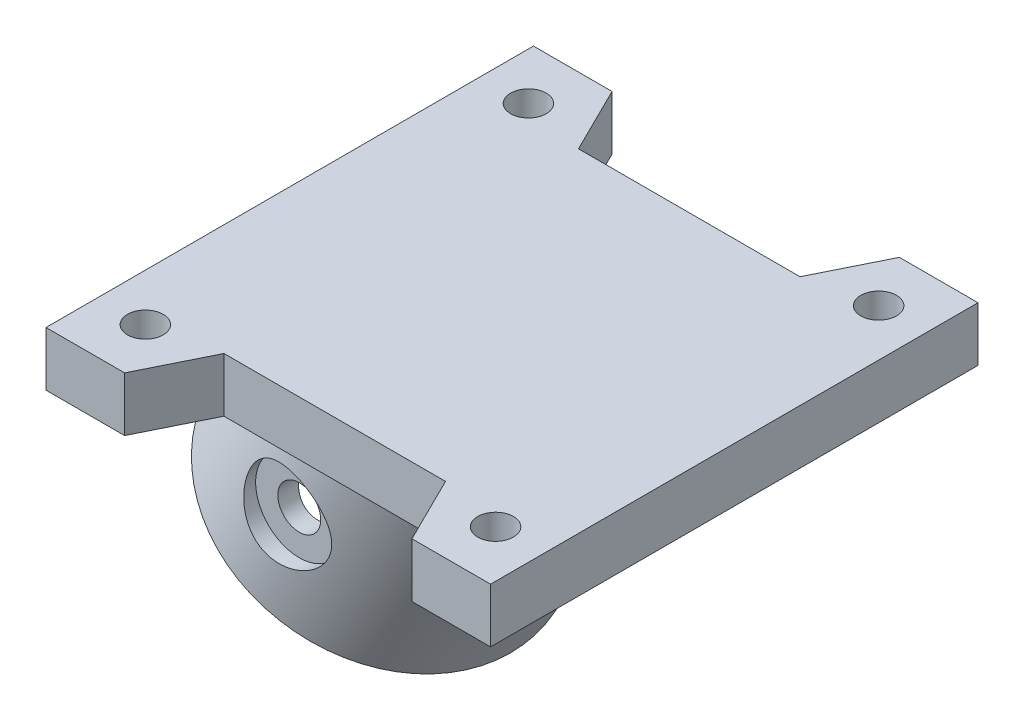
from build123d import *

# Parameters (mm, degrees)
BOSS_EXTRUDE1_DEPTH     = 3.8
CUT_EXTRUDE1_DEPTH      = 33.04999228
CUT_EXTRUDE2_DEPTH      = 30.761273573
CUT_EXTRUDE2_DEPTH_BACK = 30.761273573
SKETCH7_R               = 1.5
CUT_EXTRUDE3_DEPTH      = 8
SKETCH9_R               = 3.05
CUT_EXTRUDE4_DEPTH      = 8
SKETCH10_R              = 1.25
CUT_EXTRUDE5_DEPTH      = 33.0499924


with BuildPart() as part:
    # Sketch1 → Boss-Extrude1 (new body)
    with BuildSketch(Plane(origin=(0, 0, 0), x_dir=(1, 0, 0), z_dir=(0, 1, 0))):
        Polygon((-15.55, -17.05), (-15.55, 17.05), (-10.05, 17.05), (-7.75, 12.4), (7.75, 12.4), (10.05, 17.05), (15.55, 17.05), (15.55, -17.05), (10.05, -17.05), (7.75, -12.4), (-7.75, -12.4), (-10.05, -17.05), align=None)
    extrude(amount=BOSS_EXTRUDE1_DEPTH)

    # Revolve1: read off the stored shape, not the designer's step
    # Revolve1 outline → Revolve1 (revolve)
    with BuildSketch(Plane(origin=(-1.670959119, 0.964728697, 0), x_dir=(0.8660254037844398, -0.499999999999998, 0), z_dir=(0, 0, 1))):
        Polygon((10.200000298, -14.525), (10.200000248, 4.775000143), (3.79917118, 1.079479758), (0, 1.079479758), (0, -14.525), align=None)
    revolve(axis=Axis((-1.670959119, 0.964728697, 0), (0.499999999999998, 0.8660254037844398, 0)))

    # Sketch3 → Cut-Extrude1 (cut, through all)
    with BuildSketch(Plane(origin=(0, 3.8, 0), x_dir=(1, 0, 0), z_dir=(0, 1, 0))):
        Polygon((-10.05, 17.05), (-15.55, 17.05), (-15.55, -17.05), (-10.05, -17.05), (-7.75, -12.4), (7.75, -12.4), (10.05, -17.05), (15.55, -17.05), (15.55, 17.05), (10.05, 17.05), (7.75, 12.4), (-7.75, 12.4), align=None)
    extrude(amount=CUT_EXTRUDE1_DEPTH, mode=Mode.SUBTRACT)

    # Boundary-Cut1: read off the stored shape, not the designer's step
    # Boundary-Cut1: loft between two sections, ruled curve by curve
    boundary_cut1_from = [
        Edge.make_bspline([(-4.264195988, -14.310090618, 5.497330482), (-3.952600534, -14.489990338, 5.144451044), (-3.390059189, -14.814773735, 4.367149183), (-2.757568421, -15.17994245, 3.035429027), (-2.364627971, -15.406806725, 1.585508103), (-2.221728438, -15.489309808, 0.075173566), (-2.339233368, -15.421468305, -1.437931316), (-2.707711497, -15.208727358, -2.896270105), (-3.317731561, -14.85653211, -4.242306363), (-4.416065853, -14.222408511, -5.821756357), (-6.253782159, -13.161402507, -7.269581365), (-8.866989476, -11.652666559, -7.900430754), (-11.490387225, -10.138047163, -7.328308667), (-13.35210057, -9.063186462, -5.921916444), (-14.476778582, -8.413853309, -4.367433824), (-15.10932004, -8.048655327, -3.03533591), (-15.50227373, -7.821783409, -1.585450518), (-15.645207871, -7.739260344, -0.075222081), (-15.527690686, -7.807108923, 1.437904969), (-15.159193701, -8.019860756, 2.896296072), (-14.549188448, -8.372047453, 4.242316671), (-13.450871673, -9.006160938, 5.821729516), (-11.613084746, -10.067207715, 7.269617015), (-9.000025494, -11.575858178, 7.900380651), (-6.376366965, -13.090628136, 7.328435161), (-4.887386896, -13.95029118, 6.203089356), (-4.264195988, -14.310090618, 5.497330482)], [0, 0, 0, 0, 0.03125, 0.0625, 0.09375, 0.125, 0.15625, 0.1875, 0.21875, 0.25, 0.3125, 0.375, 0.4375, 0.5, 0.53125, 0.5625, 0.59375, 0.625, 0.65625, 0.6875, 0.71875, 0.75, 0.8125, 0.875, 0.9375, 1, 1, 1, 1], 3),
    ]
    boundary_cut1_to = [
        Edge.make_bspline([(3.535869827, 0, 6.0249567), (4.000260434, 0, 5.71827451), (4.874892388, 0, 5.020718912), (5.953015986, 0, 3.734542034), (6.720260155, 0, 2.238505144), (7.096013388, 0, 0.597243156), (7.030810986, 0, -1.085759731), (6.533226027, 0, -2.693977998), (5.66704479, 0, -4.133167867), (4.126269006, 0, -5.75895362), (1.680235047, 0, -7.172531093), (-1.628432874, 0, -7.851036071), (-4.989185483, 0, -7.528189152), (-7.581050356, 0, -6.415888298), (-9.330615811, 0, -5.020904789), (-10.408619135, 0, -3.734578971), (-11.176149314, 0, -2.238388975), (-11.55202821, 0, -0.597306131), (-11.48668895, 0, 1.0858282), (-10.988969574, 0, 2.693884042), (-10.123088416, 0, 4.133306502), (-8.582018083, 0, 5.758852747), (-6.136208886, 0, 7.172596545), (-2.827313809, 0, 7.85100057), (0.53292915, 0, 7.528284962), (2.607088614, 0, 6.63832108), (3.535869827, 0, 6.0249567)], [0, 0, 0, 0, 0.03125, 0.0625, 0.09375, 0.125, 0.15625, 0.1875, 0.21875, 0.25, 0.3125, 0.375, 0.4375, 0.5, 0.53125, 0.5625, 0.59375, 0.625, 0.65625, 0.6875, 0.71875, 0.75, 0.8125, 0.875, 0.9375, 1, 1, 1, 1], 3),
    ]
    boundary_cut1 = Solid(Shell([*[Face.make_surface_from_curves(boundary_cut1_from[k], boundary_cut1_to[k]) for k in range(1)], Face(Wire(boundary_cut1_from)), Face(Wire(boundary_cut1_to))]))
    add(boundary_cut1, mode=Mode.SUBTRACT)

    # Sketch7 → Cut-Extrude2 (cut, two sides: drawn at the far end of the back side and taken through both)
    with BuildSketch(Plane.XY.offset(-CUT_EXTRUDE2_DEPTH_BACK)):
        with Locations((-5.833459119, -6.24493279)):
            Circle(SKETCH7_R)
    extrude(amount=CUT_EXTRUDE2_DEPTH + CUT_EXTRUDE2_DEPTH_BACK, mode=Mode.SUBTRACT)

    # Sketch8 → Cut-Extrude3 (cut)
    with BuildSketch(Plane(origin=(0, 0, -17.05), x_dir=(-1, 0, 0), z_dir=(0, 0, -1))):
        Polygon((8.658459119, -4.613918279), (5.833459119, -2.982903769), (3.008459119, -4.613918279), (3.008459119, -7.8759473), (5.833459119, -9.50696181), (8.658459119, -7.8759473), align=None)
    extrude(amount=-CUT_EXTRUDE3_DEPTH, mode=Mode.SUBTRACT)

    # Sketch9 → Cut-Extrude4 (cut)
    with BuildSketch(Plane.XY.offset(17.05)):
        with Locations((-5.833459119, -6.24493279)):
            Circle(SKETCH9_R)
    extrude(amount=-CUT_EXTRUDE4_DEPTH, mode=Mode.SUBTRACT)

    # Sketch10 → Cut-Extrude5 (cut, through all)
    with BuildSketch(Plane(origin=(0, 3.8, 0), x_dir=(1, 0, 0), z_dir=(0, 1, 0))):
        with Locations(Location((-12.25, 13.4, 0), (0, 0, 270))):
            Circle(SKETCH10_R)
        with Locations(Location((-12.25, -13.4, 0), (0, 0, 270))):
            Circle(SKETCH10_R)
        with Locations(Location((12.25, -13.4, 0), (0, 0, 270))):
            Circle(SKETCH10_R)
        with Locations(Location((12.25, 13.4, 0), (0, 0, 270))):
            Circle(SKETCH10_R)
    extrude(amount=-CUT_EXTRUDE5_DEPTH, mode=Mode.SUBTRACT)


solid = part.part
